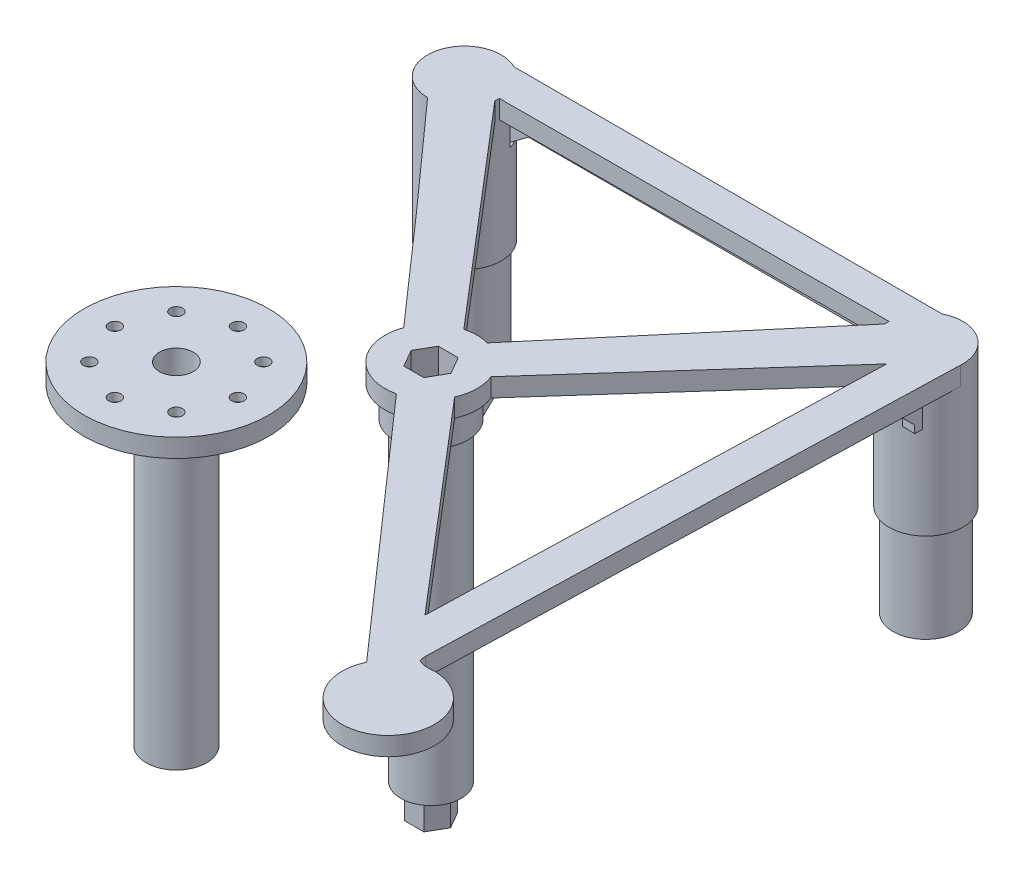
from build123d import *
from build123d.topology import SkipClean

# Parameters (mm, degrees)
EXTRUDE_1_DEPTH          = 3
SKETCH_2_R               = 5.35
EXTRUDE_2_DEPTH          = 23
CUT_EXTRUDE_1_DEPTH      = 3
SKETCH_4_R               = 5
EXTRUDE_3_DEPTH          = 100
EXTRUDE_START            = 3
SKETCH_5_R               = 5
EXTRUDE_4_DEPTH          = 3
SKETCH_6_R               = 5.35
EXTRUDE_5_DEPTH          = 5
SKETCH_7_R               = 5.35
EXTRUDE_6_DEPTH          = 5
SKETCH_8_W               = 75
SKETCH_8_H               = 10.7
EXTRUDE_7_DEPTH          = 3
EXTRUDE_8_DEPTH          = 3
CUT_EXTRUDE_2_DEPTH      = 3
SKETCH_12_R              = 6
EXTRUDE_10_DEPTH         = 13
SKETCH_13_R              = 3
CUT_EXTRUDE_3_DEPTH      = 23
SKETCH_14_R              = 3.125
CUT_EXTRUDE_5_DEPTH      = 100
SKETCH_15_R              = 6
SKETCH_15_R_2            = 5.35
EXTRUDE_11_DEPTH         = 5
SKETCH_16_R              = 6
SKETCH_16_R_2            = 3
EXTRUDE_12_DEPTH         = 5
SKETCH_17_R              = 5.35
SKETCH_17_R_2            = 3
EXTRUDE_13_DEPTH         = 5
SKETCH_18_R              = 5.35
SKETCH_18_R_2            = 3
EXTRUDE_14_DEPTH         = 5
SKETCH_20_R              = 6
SKETCH_20_R_2            = 5.35
EXTRUDE_15_DEPTH         = 5
SKETCH_21_R              = 6
SKETCH_21_R_2            = 5.35
EXTRUDE_16_DEPTH         = 5
SKETCH_22_R              = 5.35
SKETCH_22_R_2            = 3
EXTRUDE_17_DEPTH         = 5
SKETCH_23_R              = 5.35
SKETCH_23_R_2            = 3
EXTRUDE_18_DEPTH         = 5
SKETCH_25_R              = 7.5
EXTRUDE_20_DEPTH         = 3
EXTRUDE_21_DEPTH         = 3
EXTRUDE_23_DEPTH         = 3
SKETCH_30_R              = 7.5
EXTRUDE_24_DEPTH         = 3
FILLET_1_R               = 3
EXTRUDE_29_DEPTH         = 5
EXTRUDE_31_DEPTH         = 2
SKETCH_50_R              = 5.998205811
EXTRUDE_32_DEPTH         = 103
CUT_EXTRUDE_START        = -95
SKETCH_52_R              = 5.998205811
SKETCH_52_R_2            = 4.9
CUT_EXTRUDE_7_DEPTH      = 95
CUT_EXTRUDE_START_2      = -44
SKETCH_53_R              = 4.9
CUT_EXTRUDE_8_DEPTH      = 44
SKETCH_54_R              = 1.5
EXTRUDE_33_DEPTH         = 5
CUT_EXTRUDE_9_DEPTH      = 56
CUT_EXTRUDE_START_3      = -6
SKETCH_56_R              = 1.5
CUT_EXTRUDE_10_DEPTH     = 6
SKETCH_57_R              = 15
EXTRUDE_34_DEPTH         = 3
SKETCH_58_R              = 4.9
EXTRUDE_35_DEPTH         = 51
CUT_EXTRUDE_11_DEPTH     = 5
SKETCH_60_R              = 2.75
CUT_EXTRUDE_12_DEPTH     = 46
SKETCH_61_R              = 1.5
CUT_EXTRUDE_13_DEPTH     = 9
CUT_EXTRUDE_14_DEPTH     = 1.65
SKETCH_63_R              = 1
CUT_EXTRUDE_15_DEPTH     = 1.5
PATTERN_CIRCULAR_1_COUNT = 8


with BuildPart() as part:
    # 草图1 → 凸台-拉伸1 (new body)
    with BuildSketch(Plane(origin=(0, 0, 0), x_dir=(1, 0, 0), z_dir=(0, 1, 0))):
        Polygon((-18.65535641, 0), (18.84464359, -42.930983399), (56.34464359, 0), align=None)
    extrude(amount=EXTRUDE_1_DEPTH)

    # 草图2 → 凸台-拉伸2 (add)
    with BuildSketch(Plane(origin=(0, 3, 0), x_dir=(1, 0, 0), z_dir=(0, 1, 0))):
        with Locations(Location((56.34464359, 0, 0), (0, 0, 270))):
            Circle(SKETCH_2_R)
        with Locations(Location((-18.65535641, 0, 0), (0, 0, 270))):
            Circle(SKETCH_2_R)
    extrude(amount=-EXTRUDE_2_DEPTH)

    # 草图3 → 切除-拉伸1 (cut)
    with BuildSketch(Plane.XZ):
        Polygon((8.632668758, 17.559374543), (1.15609776, 9), (33.75905687, 9), (36.53318942, 9), (29.056618422, 17.559374543), (18.84464359, 29.25031113), align=None)
    extrude(amount=-CUT_EXTRUDE_1_DEPTH, mode=Mode.SUBTRACT)

    # 草图4 → 凸台-拉伸3 (add)
    with BuildSketch(Plane.XZ):
        with Locations(Location((18.84464359, 42.930983399, 0), (0, 0, 228.862949093))):
            Circle(SKETCH_4_R)
    extrude(amount=EXTRUDE_3_DEPTH)

    # 草图5 → 凸台-拉伸4 (add)
    with BuildSketch(Plane(origin=(0, 0, 0), x_dir=(1, 0, 0), z_dir=(0, 1, 0)).offset(EXTRUDE_START)):
        with Locations(Location((18.84464359, -42.930983399, 0), (0, 0, 131.137050907))):
            Circle(SKETCH_5_R)
    extrude(amount=-EXTRUDE_4_DEPTH)

    # 草图6 → 凸台-拉伸5 (add)
    with SkipClean():  # the faces are left unmerged after this step: merging them gives an invalid solid
        with BuildSketch(Plane.XZ.offset(20)):
            with Locations(Location((56.34464359, 0, 0), (0, 0, 131.137050907))):
                Circle(SKETCH_6_R)
        extrude(amount=EXTRUDE_5_DEPTH)
    add(part.part.scale(1), mode=Mode.REPLACE)  # the faces are merged on a copy

    # 草图7 → 凸台-拉伸6 (add)
    with BuildSketch(Plane.XZ.offset(20)):
        with Locations(Location((-18.65535641, 0, 0), (0, 0, 48.862949093))):
            Circle(SKETCH_7_R)
    extrude(amount=EXTRUDE_6_DEPTH)

    # 草图8 → 凸台-拉伸7 (add)
    with SkipClean():  # the faces are left unmerged after this step: merging them gives an invalid solid
        with BuildSketch(Plane(origin=(0, 3, 0), x_dir=(1, 0, 0), z_dir=(0, 1, 0))):
            with Locations((18.84464359, 0)):
                Rectangle(SKETCH_8_W, SKETCH_8_H)
        extrude(amount=-EXTRUDE_7_DEPTH)

    # 草图9 → 凸台-拉伸8 (add)
    with SkipClean():  # the faces are left unmerged after this step: merging them gives an invalid solid
        with BuildSketch(Plane(origin=(0, 3, 0), x_dir=(1, 0, 0), z_dir=(0, 1, 0))):
            Polygon((61.69464359, 0), (18.84464359, -47.930983399), (-24.00535641, 0), align=None)
        extrude(amount=-EXTRUDE_8_DEPTH)

    # 草图10 → 切除-拉伸2 (cut)
    with SkipClean():  # the faces are left unmerged after this step: merging them gives an invalid solid
        with BuildSketch(Plane.XZ):
            Polygon((18.84464359, 37.930983399), (-13.313716495, 0.298969924), (50.99464359, 0), align=None)
        extrude(amount=-CUT_EXTRUDE_2_DEPTH, mode=Mode.SUBTRACT)

    # 草图12 → 凸台-拉伸10 (add)
    with SkipClean():  # the faces are left unmerged after this step: merging them gives an invalid solid
        with BuildSketch(Plane(origin=(0, 3, 0), x_dir=(1, 0, 0), z_dir=(0, 1, 0))):
            with Locations(Location((-18.65535641, 0, 0), (0, 0, 270))):
                Circle(SKETCH_12_R)
            with Locations(Location((56.34464359, 0, 0), (0, 0, 270))):
                Circle(SKETCH_12_R)
        extrude(amount=-EXTRUDE_10_DEPTH)

    # 草图13 → 切除-拉伸3 (cut)
    with SkipClean():  # the faces are left unmerged after this step: merging them gives an invalid solid
        with BuildSketch(Plane.XZ.offset(25)):
            with Locations(Location((-18.65535641, 0, 0), (0, 0, 270))):
                Circle(SKETCH_13_R)
            with Locations(Location((56.34464359, 0, 0), (0, 0, 270))):
                Circle(SKETCH_13_R)
        extrude(amount=-CUT_EXTRUDE_3_DEPTH, mode=Mode.SUBTRACT)

    # 草图14 → 切除-拉伸5 (cut)
    with SkipClean():  # the faces are left unmerged after this step: merging them gives an invalid solid
        with BuildSketch(Plane.XZ.offset(100)):
            with Locations(Location((18.84464359, 42.930983399, 0), (0, 0, 270))):
                Circle(SKETCH_14_R)
        extrude(amount=-CUT_EXTRUDE_5_DEPTH, mode=Mode.SUBTRACT)

    # 草图15 → 凸台-拉伸11 (add)
    with SkipClean():  # the faces are left unmerged after this step: merging them gives an invalid solid
        with BuildSketch(Plane.XZ.offset(10)):
            with Locations(Location((56.34464359, 0, 0), (0, 0, 90.133194259))):
                Circle(SKETCH_15_R)
            with Locations(Location((56.34464359, 0, 0), (0, 0, 270))):
                Circle(SKETCH_15_R_2, mode=Mode.SUBTRACT)
        extrude(amount=EXTRUDE_11_DEPTH)

    # 草图16 → 凸台-拉伸12 (add)
    with SkipClean():  # the faces are left unmerged after this step: merging them gives an invalid solid
        with BuildSketch(Plane.XZ.offset(10)):
            with Locations(Location((-18.65535641, 0, 0), (0, 0, 89.866805741))):
                Circle(SKETCH_16_R)
            with Locations(Location((-18.65535641, 0, 0), (0, 0, 270))):
                Circle(SKETCH_16_R_2, mode=Mode.SUBTRACT)
        extrude(amount=EXTRUDE_12_DEPTH)

    # 草图17 → 凸台-拉伸13 (add)
    with SkipClean():  # the faces are left unmerged after this step: merging them gives an invalid solid
        with BuildSketch(Plane.XZ.offset(25)):
            with Locations(Location((-18.65535641, 0, 0), (0, 0, 270))):
                Circle(SKETCH_17_R)
            with Locations(Location((-18.65535641, 0, 0), (0, 0, 270))):
                Circle(SKETCH_17_R_2, mode=Mode.SUBTRACT)
        extrude(amount=EXTRUDE_13_DEPTH)

    # 草图18 → 凸台-拉伸14 (add)
    with SkipClean():  # the faces are left unmerged after this step: merging them gives an invalid solid
        with BuildSketch(Plane.XZ.offset(25)):
            with Locations(Location((56.34464359, 0, 0), (0, 0, 270))):
                Circle(SKETCH_18_R)
            with Locations(Location((56.34464359, 0, 0), (0, 0, 270))):
                Circle(SKETCH_18_R_2, mode=Mode.SUBTRACT)
        extrude(amount=EXTRUDE_14_DEPTH)

    # 草图20 → 凸台-拉伸15 (add)
    with SkipClean():  # the faces are left unmerged after this step: merging them gives an invalid solid
        with BuildSketch(Plane.XZ.offset(15)):
            with Locations(Location((-18.65535641, 0, 0), (0, 0, 89.866805741))):
                Circle(SKETCH_20_R)
            with Locations(Location((-18.65535641, 0, 0), (0, 0, 270))):
                Circle(SKETCH_20_R_2, mode=Mode.SUBTRACT)
        extrude(amount=EXTRUDE_15_DEPTH)

    # 草图21 → 凸台-拉伸16 (add)
    with SkipClean():  # the faces are left unmerged after this step: merging them gives an invalid solid
        with BuildSketch(Plane.XZ.offset(15)):
            with Locations(Location((56.34464359, 0, 0), (0, 0, 90.133194259))):
                Circle(SKETCH_21_R)
            with Locations(Location((56.34464359, 0, 0), (0, 0, 270))):
                Circle(SKETCH_21_R_2, mode=Mode.SUBTRACT)
        extrude(amount=EXTRUDE_16_DEPTH)

    # 草图22 → 凸台-拉伸17 (add)
    with SkipClean():  # the faces are left unmerged after this step: merging them gives an invalid solid
        with BuildSketch(Plane.XZ.offset(30)):
            with Locations(Location((-18.65535641, 0, 0), (0, 0, 270))):
                Circle(SKETCH_22_R)
            with Locations(Location((-18.65535641, 0, 0), (0, 0, 270))):
                Circle(SKETCH_22_R_2, mode=Mode.SUBTRACT)
        extrude(amount=EXTRUDE_17_DEPTH)

    # 草图23 → 凸台-拉伸18 (add)
    with SkipClean():  # the faces are left unmerged after this step: merging them gives an invalid solid
        with BuildSketch(Plane.XZ.offset(30)):
            with Locations(Location((56.34464359, 0, 0), (0, 0, 270))):
                Circle(SKETCH_23_R)
            with Locations(Location((56.34464359, 0, 0), (0, 0, 270))):
                Circle(SKETCH_23_R_2, mode=Mode.SUBTRACT)
        extrude(amount=EXTRUDE_18_DEPTH)

    # 草图25 → 凸台-拉伸20 (add)
    with SkipClean():  # the faces are left unmerged after this step: merging them gives an invalid solid
        with BuildSketch(Plane(origin=(0, 3, 0), x_dir=(1, 0, 0), z_dir=(0, 1, 0))):
            with Locations((18.84464359, -42.930983399)):
                Circle(SKETCH_25_R)
        extrude(amount=-EXTRUDE_20_DEPTH)

    # 草图28 → 凸台-拉伸21 (add)
    with SkipClean():  # the faces are left unmerged after this step: merging them gives an invalid solid
        with BuildSketch(Plane(origin=(0, 3, 0), x_dir=(1, 0, 0), z_dir=(0, 1, 0))):
            Polygon((-3.379636645, -23.071435978), (2.093554995, -18.328702995), (68.652557408, -96.216669577), (66.868599364, -97.910067347), (64.321605904, -100.026810209), align=None)
        extrude(amount=-EXTRUDE_21_DEPTH)

    # 草图29 → 凸台-拉伸23 (add)
    with SkipClean():  # the faces are left unmerged after this step: merging them gives an invalid solid
        with BuildSketch(Plane(origin=(0, 3, 0), x_dir=(1, 0, 0), z_dir=(0, 1, 0))):
            Polygon((56.34464359, 0), (53.74105837, -88), (59.74105837, -88), (62.34464359, 0), align=None)
        extrude(amount=-EXTRUDE_23_DEPTH)

    # 草图30 → 凸台-拉伸24 (add)
    with SkipClean():  # the faces are left unmerged after this step: merging them gives an invalid solid
        with BuildSketch(Plane(origin=(0, 3, 0), x_dir=(1, 0, 0), z_dir=(0, 1, 0))):
            with Locations((62.6531538, -93.694621783)):
                Circle(SKETCH_30_R)
        extrude(amount=-EXTRUDE_24_DEPTH)

    # 圆角1
    # the kernel refuses this fillet: 3 mm, written as the material it adds along each edge
    with BuildSketch(Plane(origin=(60.387632696, 0, 86.544977448), x_dir=(-0.6496534253779116, 0, -0.760230509052844), z_dir=(0, 1, 0))) as fillet_1_piece_1:
        with BuildLine():
            CenterArc((1.763131122, -3), FILLET_1_R, 90, 55.663998218)
            ThreePointArc((-0.714100998, -1.307864951), (-0.324488751, -0.671711358), (0, 0))
            Line((0, 0), (1.763131122, 0))
        make_face()
    extrude(amount=3)
    with BuildSketch(Plane(origin=(59.804303017, 0, 85.862359607), x_dir=(0.02957325513951661, 0, -0.9995626156376863), z_dir=(0, 1, 0))) as fillet_1_piece_2:
        with BuildLine():
            CenterArc((FILLET_1_R * 0.38596961824, -FILLET_1_R), FILLET_1_R, 90, 42.210146514)
            Line((-FILLET_1_R * 0.285882149698, -FILLET_1_R * 0.259314370385), (0, 0))
            Line((0, 0), (FILLET_1_R * 0.38596961824, 0))
        make_face()
    extrude(amount=3)

    # 草图31 → 凸台-拉伸29 (add)
    with BuildSketch(Plane.XZ):
        Polygon((-14.723586471, -1.628179316), (-14.723586471, -3.628179316), (53.527409972, -3.628179316), (53.82491501, -1.628179316), align=None)
        Polygon((49.609847968, 80.102545011), (51.130308987, 78.80323816), (22.318773999, 45.087710689), (20.798312981, 46.38701754), align=None)
        Polygon((-15.349607435, 4.086383285), (-13.829146417, 2.787076434), (17.097273349, 38.977461836), (15.576812331, 40.276768687), align=None)
        Polygon((20.325894576, 39.186783249), (51.86894969, 1.971881231), (53.394639731, 3.265043982), (21.851584617, 40.479945999), align=None)
        Polygon((56.093860655, 78.864293565), (58.318881117, 3.659610745), (60.319756269, 3.659610745), (58.092985887, 78.923440075), align=None)
    extrude(amount=EXTRUDE_29_DEPTH)

    # 切除-扫描1: sweep along a path in 草图36
    with BuildLine(Plane.XZ.offset(5)) as sweep_1_path:
        Line((18.84464359, -3.628179316), (18.84464359, -1.628179316))
    # 草图35 → 切除-扫描1 (sweep, cut)
    with BuildSketch(Plane(origin=(0, 0, -3.628179316), x_dir=(-1, 0, 0), z_dir=(0, 0, -1))):
        Polygon((13.876620714, -5), (9.876620714, -2), (-47.565907894, -2), (-51.565907894, -5), align=None)
    sweep(path=sweep_1_path.line, mode=Mode.SUBTRACT)

    # 切除-扫描3: sweep along a path in 草图38
    with BuildLine(Plane.XZ.offset(5)) as sweep_3_path:
        Line((59.19369399, 41.720005215), (57.192818839, 41.720005215))
    # 草图37 → 切除-扫描3 (sweep, cut)
    with BuildSketch(Plane(origin=(60.375181238, 0, 1.786271926), x_dir=(0.029573255139513054, 0, -0.9995626156376864), z_dir=(0.9995626156376866, 0, 0.029573255139513057))):
        Polygon((-2.73149314, -5), (-6.73149314, -1), (-73.170921503, -1), (-77.170921503, -5), align=None)
    sweep(path=sweep_3_path.line, mode=Mode.SUBTRACT)

    # 草图39 → 凸台-拉伸31 (add)
    with BuildSketch(Plane(origin=(58.376056006, 0, 1.727125416), x_dir=(0.02957325513951297, 0, -0.9995626156376864), z_dir=(0.9995626156376866, 0, 0.029573255139512974))):
        Polygon((-3.961044, -3.829621531), (-3.961044, -5), (-2.73149314, -5), (-2.73149314, -4.501704435), (-3.961044, -3.272153575), align=None)
    extrude(amount=EXTRUDE_31_DEPTH)

    # 切除-扫描5: sweep along a path in 草图42
    with BuildLine(Plane.XZ.offset(5)) as sweep_5_path:
        Line((0.095091388, 22.159914171), (1.552120507, 20.786378718))
    # 草图40 → 切除-扫描5 (sweep, cut)
    with BuildSketch(Plane(origin=(-10.889521113, 0, 9.305617977), x_dir=(0.6496534253779145, 0, 0.7602305090528415), z_dir=(-0.7602305090528415, 0, 0.6496534253779145))):
        Polygon((-5.121187346, -5), (-3.121187346, -1), (36.9380259, -1), (38.9380259, -5), align=None)
    sweep(path=sweep_5_path.line, mode=Mode.SUBTRACT)

    # 切除-扫描6: sweep along a path in 草图44
    with BuildLine(Plane.XZ.offset(5)) as sweep_6_path:
        Line((36.035656698, 20.652203895), (37.472857905, 22.049766909))
    # 草图43 → 切除-扫描6 (sweep, cut)
    with BuildSketch(Plane(origin=(31.1568423, 0, 26.408291855), x_dir=(-0.6465813751887421, 0, 0.7628450204720715), z_dir=(-0.7628450204720715, 0, -0.6465813751887421))):
        Polygon((14.734624595, -5), (12.734624595, -1), (-27.825731715, -1), (-29.825731715, -5), align=None)
    sweep(path=sweep_6_path.line, mode=Mode.SUBTRACT)

    # 切除-扫描7: sweep along a path in 草图47
    with BuildLine(Plane.XZ.offset(5)) as sweep_7_path:
        Line((37.03221924, 62.305521799), (35.511758222, 63.60482865))
    # 草图46 → 切除-扫描7 (sweep, cut)
    with BuildSketch(Plane(origin=(-10.889521113, 0, 9.305617977), x_dir=(0.6496534253779142, 0, 0.7602305090528417), z_dir=(-0.7602305090528417, 0, 0.6496534253779142))):
        Polygon((50.821835343, -5), (52.821835343, -1), (88.125606235, -1), (93.125606235, 0), (93.125606235, -5), align=None)
    sweep(path=sweep_7_path.line, mode=Mode.SUBTRACT)

    # 切除-扫描8: sweep along a path in 草图49
    with BuildLine(Plane.XZ.offset(1)) as sweep_8_path:
        Line((58.211278907, 74.925189613), (56.210403756, 74.925189613))
        Line((56.210403756, 74.925189613), (55.379994456, 74.925189613))
    # 草图48 → 切除-扫描8 (sweep, cut)
    with BuildSketch(Plane(origin=(60.375181238, 0, 1.786271926), x_dir=(0.029573255139513054, 0, -0.9995626156376864), z_dir=(0.9995626156376866, 0, 0.029573255139513057))):
        Polygon((-73.170921503, -1), (-77.170921503, 0), (-77.170921503, -5), align=None)
    sweep(path=sweep_8_path.line, mode=Mode.SUBTRACT)

    # 草图50 → 凸台-拉伸32 (add)
    with BuildSketch(Plane(origin=(0, 3, 0), x_dir=(1, 0, 0), z_dir=(0, 1, 0))):
        with Locations(Location((18.84464359, -42.930983399, 0), (0, 0, 270))):
            Circle(SKETCH_50_R)
    extrude(amount=-EXTRUDE_32_DEPTH)

    # 草图52 → 切除-拉伸7 (cut)
    with BuildSketch(Plane.XZ.offset(100).offset(CUT_EXTRUDE_START)):
        with Locations((18.84464359, 42.930983399)):
            Circle(SKETCH_52_R)
        with Locations(Location((18.84464359, 42.930983399, 0), (0, 0, 270))):
            Circle(SKETCH_52_R_2, mode=Mode.SUBTRACT)
    extrude(amount=CUT_EXTRUDE_7_DEPTH, mode=Mode.SUBTRACT)

    # 草图53 → 切除-拉伸8 (cut)
    with BuildSketch(Plane.XZ.offset(100).offset(CUT_EXTRUDE_START_2)):
        with Locations(Location((18.84464359, 42.930983399, 0), (0, 0, 270))):
            Circle(SKETCH_53_R)
    extrude(amount=CUT_EXTRUDE_8_DEPTH, mode=Mode.SUBTRACT)

    # 草图54 → 凸台-拉伸33 (add)
    with BuildSketch(Plane.XZ.offset(56)):
        Polygon((22.020070071, 42.930983399), (20.43235683, 45.680983399), (17.25693035, 45.680983399), (15.669217109, 42.930983399), (17.25693035, 40.180983399), (20.43235683, 40.180983399), align=None)
        with Locations(Location((18.84464359, 42.930983399, 0), (0, 0, 270))):
            Circle(SKETCH_54_R, mode=Mode.SUBTRACT)
    extrude(amount=EXTRUDE_33_DEPTH)

    # 草图55 → 切除-拉伸9 (cut)
    with BuildSketch(Plane(origin=(0, 3, 0), x_dir=(1, 0, 0), z_dir=(0, 1, 0))):
        Polygon((22.077805097, -42.930983399), (20.461224344, -40.130983399), (17.228062836, -40.130983399), (15.611482083, -42.930983399), (17.228062836, -45.730983399), (20.461224344, -45.730983399), align=None)
    extrude(amount=-CUT_EXTRUDE_9_DEPTH, mode=Mode.SUBTRACT)

    # 草图56 → 切除-拉伸10 (cut)
    with BuildSketch(Plane.XZ.offset(56).offset(CUT_EXTRUDE_START_3)):
        with Locations(Location((18.84464359, 42.930983399, 0), (0, 0, 90))):
            Circle(SKETCH_56_R)
    extrude(amount=CUT_EXTRUDE_10_DEPTH, mode=Mode.SUBTRACT)


with BuildPart() as body_2:
    # 草图57 → 凸台-拉伸34 (new body)
    with BuildSketch(Plane(origin=(0, 0, 0), x_dir=(1, 0, 0), z_dir=(0, 1, 0))):
        with Locations(Location((-1.85085497, -63.626481958, 0), (0, 0, 270))):
            Circle(SKETCH_57_R)
    extrude(amount=EXTRUDE_34_DEPTH)

    # 草图58 → 凸台-拉伸35 (add)
    with BuildSketch(Plane.XZ):
        with Locations(Location((-1.85085497, 63.626481958, 0), (0, 0, 90))):
            Circle(SKETCH_58_R)
    extrude(amount=EXTRUDE_35_DEPTH)

    # 草图59 → 切除-拉伸11 (cut)
    with BuildSketch(Plane.XZ.offset(51)):
        Polygon((1.324571511, 63.626481958), (-0.263141729, 66.376481958), (-3.43856821, 66.376481958), (-5.02628145, 63.626481958), (-3.43856821, 60.876481958), (-0.263141729, 60.876481958), align=None)
    extrude(amount=-CUT_EXTRUDE_11_DEPTH, mode=Mode.SUBTRACT)

    # 草图60 → 切除-拉伸12 (cut)
    with BuildSketch(Plane(origin=(0, 3, 0), x_dir=(1, 0, 0), z_dir=(0, 1, 0))):
        with Locations(Location((-1.85085497, -63.626481958, 0), (0, 0, 270))):
            Circle(SKETCH_60_R)
    extrude(amount=-CUT_EXTRUDE_12_DEPTH, mode=Mode.SUBTRACT)

    # 草图61 → 切除-拉伸13 (cut)
    with BuildSketch(Plane.XZ.offset(46)):
        with Locations(Location((-1.85085497, 63.626481958, 0), (0, 0, 270))):
            Circle(SKETCH_61_R)
    extrude(amount=-CUT_EXTRUDE_13_DEPTH, mode=Mode.SUBTRACT)

    # 草图62 → 切除-拉伸14 (cut)
    with BuildSketch(Plane.XZ):
        Polygon((10.516281134, 63.626481958), (9.332713082, 65.676481958), (6.965576978, 65.676481958), (5.782008927, 63.626481958), (6.965576978, 61.576481958), (9.332713082, 61.576481958), align=None)
    cut_extrude_14 = extrude(amount=-CUT_EXTRUDE_14_DEPTH, mode=Mode.SUBTRACT)

    # 草图63 → 切除-拉伸15 (cut)
    with BuildSketch(Plane.XZ.offset(-1.65)):
        with Locations(Location((8.14914503, 63.626481958, 0), (0, 0, 270))):
            Circle(SKETCH_63_R)
    cut_extrude_15 = extrude(amount=-CUT_EXTRUDE_15_DEPTH, mode=Mode.SUBTRACT)

    # 阵列(圆周)1: 切除-拉伸14, 切除-拉伸15 ×8 about axis
    pattern_circular_1_axis = Axis((-1.85085497, 0, 63.626481958), (0, 1, 0))
    add([cut_extrude_14.rotate(pattern_circular_1_axis, i * 360 / PATTERN_CIRCULAR_1_COUNT) for i in range(1, PATTERN_CIRCULAR_1_COUNT)], mode=Mode.SUBTRACT)
    add([cut_extrude_15.rotate(pattern_circular_1_axis, i * 360 / PATTERN_CIRCULAR_1_COUNT) for i in range(1, PATTERN_CIRCULAR_1_COUNT)], mode=Mode.SUBTRACT)


solid = Compound([part.part, body_2.part])
